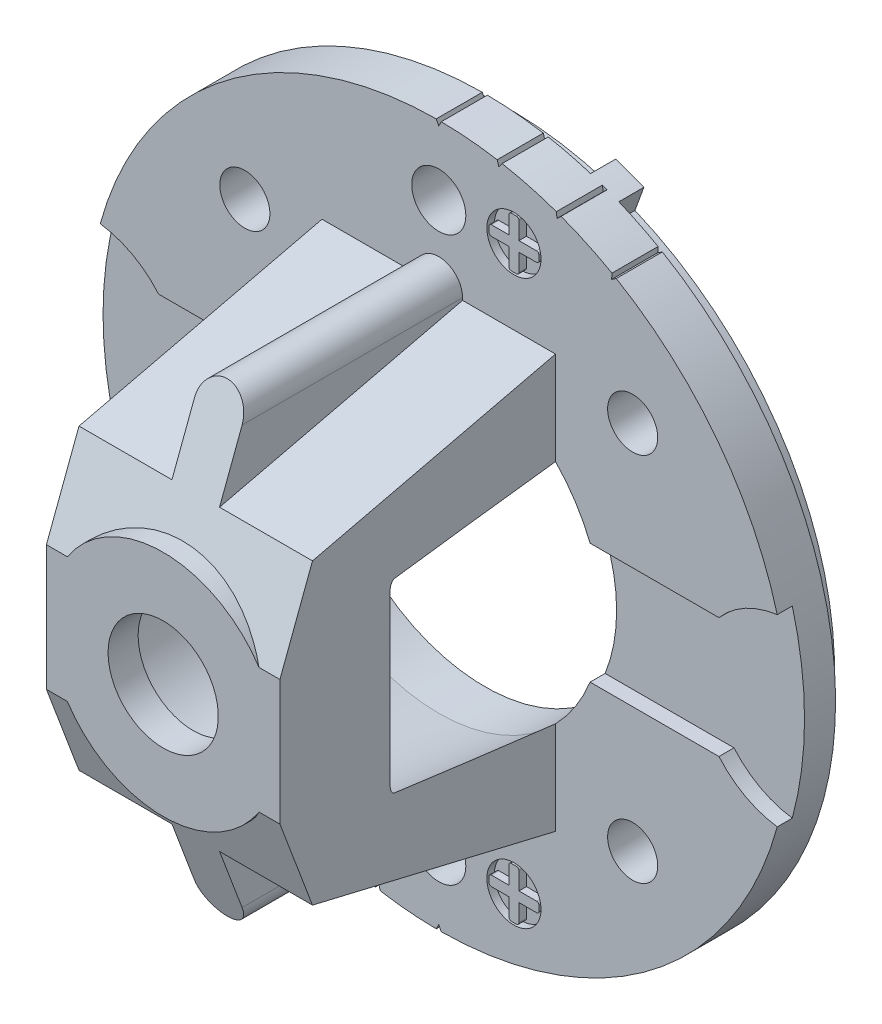
from build123d import *

# Parameters (mm, degrees)
SKETCH1_R           = 17.78
SKETCH1_R_2         = 2.794
BOSS_EXTRUDE1_DEPTH = 2.3368
SKETCH2_W           = 11.8364
SKETCH2_H           = 20.955
BOSS_EXTRUDE2_DEPTH = 13.97
CUT_EXTRUDE1_DEPTH  = 13.97
SKETCH4_R           = 5.8039
BOSS_EXTRUDE3_DEPTH = 2.54
BOSS_EXTRUDE4_DEPTH = 12.7
CUT_EXTRUDE2_DEPTH  = 34.817817929
SKETCH7_R           = 2.794
CUT_EXTRUDE3_DEPTH  = 30.969459892
SKETCH8_R           = 8.255
CUT_EXTRUDE4_DEPTH  = 2.3368
SKETCH10_R          = 16.4592
SKETCH10_R_2        = 15.4432
BOSS_EXTRUDE5_DEPTH = 1.27
CUT_EXTRUDE5_START  = -0.762
CUT_EXTRUDE5_DEPTH  = 0.762
BOSS_EXTRUDE6_DEPTH = 1.27
SKETCH13_R          = 1.3716
CUT_EXTRUDE6_DEPTH  = 29.764869247
SKETCH14_R          = 1.3716
CUT_EXTRUDE7_DEPTH  = 0.381
CUT_EXTRUDE8_START  = -2.3368
CUT_EXTRUDE8_DEPTH  = 2.3368
SKETCH19_R          = 1.27
CUT_EXTRUDE9_DEPTH  = 30.969190855


# Read off the part's stored shape, not the designer's step: Cut-Extrude8
with BuildPart() as part:
    # Sketch1 → Boss-Extrude1 (new body)
    with BuildSketch(Plane.XY):
        Circle(SKETCH1_R)
        Circle(SKETCH1_R_2, mode=Mode.SUBTRACT)
    extrude(amount=BOSS_EXTRUDE1_DEPTH)

    # Sketch2 → Boss-Extrude2 (add)
    with BuildSketch(Plane.XY.offset(2.3368)):
        Rectangle(SKETCH2_W, SKETCH2_H)
    extrude(amount=BOSS_EXTRUDE2_DEPTH)

    # Sketch3 → Cut-Extrude1 (cut)
    with BuildSketch(Plane(origin=(5.9182, 0, 0), x_dir=(0, 0, -1), z_dir=(1, 0, 0))):
        Polygon((-16.3068, 10.4775), (-2.3368, 10.4775), (-14.6558, 7.5565), (-16.3068, 3.175), align=None)
        Polygon((-2.3368, -10.4775), (-14.6558, -7.5565), (-16.3068, -3.175), (-16.3068, -10.4775), align=None)
    extrude(amount=-CUT_EXTRUDE1_DEPTH, mode=Mode.SUBTRACT)

    # Sketch4 → Boss-Extrude3 (add)
    with BuildSketch(Plane.XY.offset(16.3068)):
        Circle(SKETCH4_R)
    extrude(amount=-BOSS_EXTRUDE3_DEPTH)

    # Sketch5 → Boss-Extrude4 (add)
    with BuildSketch(Plane.XY.offset(2.3368)):
        with BuildLine():
            Line((1.2065, 10.5918), (1.2065, 3.922286562))
            ThreePointArc((1.2065, 3.922286562), (0, 2.715786562), (-1.2065, 3.922286562))
            Line((-1.2065, 3.922286562), (-1.2065, 10.5918))
            ThreePointArc((-1.2065, 10.5918), (0, 11.7983), (1.2065, 10.5918))
        make_face()
        with BuildLine():
            Line((1.2065, -10.5918), (1.2065, -3.922286562))
            ThreePointArc((1.2065, -3.922286562), (0, -2.715786562), (-1.2065, -3.922286562))
            Line((-1.2065, -3.922286562), (-1.2065, -10.5918))
            ThreePointArc((-1.2065, -10.5918), (0, -11.7983), (1.2065, -10.5918))
        make_face()
    extrude(amount=BOSS_EXTRUDE4_DEPTH)

    # Sketch6 → Cut-Extrude2 (cut, through all)
    with BuildSketch(Plane(origin=(5.9182, 0, 0), x_dir=(0, 0, -1), z_dir=(1, 0, 0))):
        Polygon((-13.05744058, -11.7983), (-14.6558, -7.5565), (-15.3162, -5.8039), (-16.3068, -5.8039), (-16.3068, -11.7983), align=None)
        Polygon((-16.3068, 5.8039), (-16.3068, 11.7983), (-13.05744058, 11.7983), (-15.3162, 5.8039), align=None)
    extrude(amount=-CUT_EXTRUDE2_DEPTH, mode=Mode.SUBTRACT)

    # Sketch7 → Cut-Extrude3 (cut, through all)
    with BuildSketch(Plane(origin=(0, 0, 0), x_dir=(-1, 0, 0), z_dir=(0, 0, -1))):
        Circle(SKETCH7_R)
    extrude(amount=-CUT_EXTRUDE3_DEPTH, mode=Mode.SUBTRACT)

    # Sketch8 → Cut-Extrude4 (cut)
    with BuildSketch(Plane(origin=(0, 0, 0), x_dir=(-1, 0, 0), z_dir=(0, 0, -1))):
        Circle(SKETCH8_R)
    extrude(amount=-CUT_EXTRUDE4_DEPTH, mode=Mode.SUBTRACT)

    # Sketch9 → Cut-Revolve1 (revolve, cut)
    with BuildSketch(Plane(origin=(0, 0, 0), x_dir=(0, 0, -1), z_dir=(1, 0, 0)), mode=Mode.PRIVATE) as cut_revolve1_sk:
        with BuildLine():
            Line((-10.486274354, 7.563529449), (-2.3368, 8.255))
            Line((-2.3368, 8.255), (0, 8.255))
            Line((0, 8.255), (0, 0))
            Line((0, 0), (-14.7828, 0))
            Line((-14.7828, 0), (-14.7828, 4.4958))
            ThreePointArc((-14.7828, 4.4958), (-14.708405122, 4.675405122), (-14.5288, 4.7498))
            Line((-14.5288, 4.7498), (-10.9728, 4.7498))
            ThreePointArc((-10.9728, 4.7498), (-10.793194878, 4.824194878), (-10.7188, 5.0038))
            Line((-10.7188, 5.0038), (-10.7188, 7.310438848))
            ThreePointArc((-10.7188, 7.310438848), (-10.651843425, 7.482284002), (-10.486274354, 7.563529449))
        make_face()
    revolve(cut_revolve1_sk.sketch.rotate(Axis((0, 0, -0.972451084), (0, 0, 1)), 90), axis=Axis((0, 0, -0.972451084), (0, 0, 1)), mode=Mode.SUBTRACT)

    # Sketch10 → Boss-Extrude5 (add)
    with BuildSketch(Plane(origin=(0, 0, 0), x_dir=(-1, 0, 0), z_dir=(0, 0, -1))):
        with Locations(Location((0, 0, 0), (0, 0, 180))):
            Circle(SKETCH10_R)
        Circle(SKETCH10_R_2, mode=Mode.SUBTRACT)
    extrude(amount=BOSS_EXTRUDE5_DEPTH)

    # Sketch11 → Cut-Extrude5 (cut)
    with BuildSketch(Plane.XY.offset(2.3368).offset(CUT_EXTRUDE5_START)):
        with BuildLine():
            Line((-14.203647529, 3.048), (-7.671683062, 3.048))
            ThreePointArc((-7.671683062, 3.048), (-8.255, 0), (-7.671683062, -3.048))
            Line((-7.671683062, -3.048), (-14.203647529, -3.048))
            ThreePointArc((-14.203647529, -3.048), (-15.532296087, -4.126551602), (-17.159060714, -4.657792976))
            ThreePointArc((-17.159060714, -4.657792976), (-17.78, 0), (-17.159060714, 4.657792976))
            ThreePointArc((-17.159060714, 4.657792976), (-15.532296087, 4.126551602), (-14.203647529, 3.048))
        make_face()
        with BuildLine():
            Line((14.203647529, 3.048), (7.671683062, 3.048))
            ThreePointArc((7.671683062, 3.048), (8.255, 0), (7.671683062, -3.048))
            Line((7.671683062, -3.048), (14.203647529, -3.048))
            ThreePointArc((14.203647529, -3.048), (15.532296087, -4.126551602), (17.159060714, -4.657792976))
            ThreePointArc((17.159060714, -4.657792976), (17.78, 0), (17.159060714, 4.657792976))
            ThreePointArc((17.159060714, 4.657792976), (15.532296087, 4.126551602), (14.203647529, 3.048))
        make_face()
    extrude(amount=CUT_EXTRUDE5_DEPTH, mode=Mode.SUBTRACT)

    # Sketch12 → Boss-Extrude6 (add)
    with BuildSketch(Plane(origin=(0, 0, -1.27), x_dir=(-1, 0, 0), z_dir=(0, 0, -1))):
        with BuildLine():
            Line((-6.791576658, 16.431764558), (-6.339387629, 15.18938541))
            ThreePointArc((-6.339387629, 15.18938541), (-5.629377943, 15.466588784), (-4.907296075, 15.710624108))
            Line((-4.907296075, 15.710624108), (-5.359485104, 16.953003257))
            ThreePointArc((-5.359485104, 16.953003257), (-6.081118148, 16.707734798), (-6.791576658, 16.431764558))
        make_face()
    extrude(amount=-BOSS_EXTRUDE6_DEPTH)

    # Sketch13 → Cut-Extrude6 (cut, through all)
    with BuildSketch(Plane.XY.offset(2.3368)):
        with Locations((0, 14.2748)):
            Circle(SKETCH13_R)
        with Locations(Location((0, -14.2748, 0), (0, 0, 302.999911245))):
            Circle(SKETCH13_R)
    extrude(amount=-CUT_EXTRUDE6_DEPTH, mode=Mode.SUBTRACT)

    # Sketch14 → Cut-Extrude7 (cut)
    # profile 1 of 2: a face of its own
    with BuildSketch(Plane.XY.offset(2.3368)):
        with Locations((3.81, 14.2748)):
            Circle(SKETCH14_R)
        with BuildLine():
            Line((5.08, 14.1478), (5.08, 14.4018))
            ThreePointArc((5.08, 14.4018), (5.042802561, 14.491602561), (4.953, 14.5288))
            Line((4.953, 14.5288), (4.064, 14.5288))
            Line((4.064, 14.5288), (4.064, 15.4178))
            ThreePointArc((4.064, 15.4178), (4.026802561, 15.507602561), (3.937, 15.5448))
            Line((3.937, 15.5448), (3.683, 15.5448))
            ThreePointArc((3.683, 15.5448), (3.593197439, 15.507602561), (3.556, 15.4178))
            Line((3.556, 15.4178), (3.556, 14.5288))
            Line((3.556, 14.5288), (2.667, 14.5288))
            ThreePointArc((2.667, 14.5288), (2.577197439, 14.491602561), (2.54, 14.4018))
            Line((2.54, 14.4018), (2.54, 14.1478))
            ThreePointArc((2.54, 14.1478), (2.577197439, 14.057997439), (2.667, 14.0208))
            Line((2.667, 14.0208), (3.556, 14.0208))
            Line((3.556, 14.0208), (3.556, 13.1318))
            ThreePointArc((3.556, 13.1318), (3.593197439, 13.041997439), (3.683, 13.0048))
            Line((3.683, 13.0048), (3.937, 13.0048))
            ThreePointArc((3.937, 13.0048), (4.026802561, 13.041997439), (4.064, 13.1318))
            Line((4.064, 13.1318), (4.064, 14.0208))
            Line((4.064, 14.0208), (4.953, 14.0208))
            ThreePointArc((4.953, 14.0208), (5.042802561, 14.057997439), (5.08, 14.1478))
        make_face(mode=Mode.SUBTRACT)
    # profile 2 of 2: a face of its own
    with BuildSketch(Plane.XY.offset(2.3368)):
        with Locations((3.81, -14.2748)):
            Circle(SKETCH14_R)
        with BuildLine():
            Line((3.556, -14.5288), (3.556, -15.4178))
            ThreePointArc((3.556, -15.4178), (3.593197439, -15.507602561), (3.683, -15.5448))
            Line((3.683, -15.5448), (3.937, -15.5448))
            ThreePointArc((3.937, -15.5448), (4.026802561, -15.507602561), (4.064, -15.4178))
            Line((4.064, -15.4178), (4.064, -14.5288))
            Line((4.064, -14.5288), (4.953, -14.5288))
            ThreePointArc((4.953, -14.5288), (5.042802561, -14.491602561), (5.08, -14.4018))
            Line((5.08, -14.4018), (5.08, -14.1478))
            ThreePointArc((5.08, -14.1478), (5.042802561, -14.057997439), (4.953, -14.0208))
            Line((4.953, -14.0208), (4.064, -14.0208))
            Line((4.064, -14.0208), (4.064, -13.1318))
            ThreePointArc((4.064, -13.1318), (4.026802561, -13.041997439), (3.937, -13.0048))
            Line((3.937, -13.0048), (3.683, -13.0048))
            ThreePointArc((3.683, -13.0048), (3.593197439, -13.041997439), (3.556, -13.1318))
            Line((3.556, -13.1318), (3.556, -14.0208))
            Line((3.556, -14.0208), (2.667, -14.0208))
            ThreePointArc((2.667, -14.0208), (2.577197439, -14.057997439), (2.54, -14.1478))
            Line((2.54, -14.1478), (2.54, -14.4018))
            ThreePointArc((2.54, -14.4018), (2.577197439, -14.491602561), (2.667, -14.5288))
            Line((2.667, -14.5288), (3.556, -14.5288))
        make_face(mode=Mode.SUBTRACT)
    extrude(amount=-CUT_EXTRUDE7_DEPTH, mode=Mode.SUBTRACT)

    # Cut-Extrude8 outline → Cut-Extrude8 (cut)
    with BuildSketch(Plane.XY.offset(2.3368).offset(CUT_EXTRUDE8_START)):
        Polygon((-0.127, 17.779546423), (0, 17.525546423), (0.127, 17.779546423), (0.237226789, 18), (-0.237226789, 18), align=None)
        Polygon((3.592675338, 18), (2.82295702, 18), (2.962315251, 17.531488481), (3.043279199, 17.259293993), (3.212456421, 17.487381844), align=None)
        Polygon((-8.999758438, -15.33403887), (-9, -15.334198362), (-9, -18), (-8.932184291, -18), (-8.779787985, -15.46103887), (-8.762773211, -15.177568417), align=None)
        Polygon((7.611494458, 18), (5.817850493, 18), (5.961622053, 16.750745133), (5.994089899, 16.468626649), (6.200303979, 16.663872016), align=None)
        Polygon((9, 18), (8.932184291, 18), (8.779787985, 15.46103887), (8.762773211, 15.177568417), (8.999758438, 15.33403887), (9, 15.334198362), align=None)
        Polygon((-6.200303979, -16.663872016), (-7.611494458, -18), (-5.817850493, -18), (-5.961622053, -16.750745133), (-5.994089899, -16.468626649), align=None)
        Polygon((-3.212456421, -17.487381844), (-3.592675338, -18), (-2.82295702, -18), (-2.962315251, -17.531488481), (-3.043279199, -17.259293993), align=None)
        Polygon((-0.237226789, -18), (0.237226789, -18), (0.127, -17.779546423), (0, -17.525546423), (-0.127, -17.779546423), align=None)
    extrude(amount=CUT_EXTRUDE8_DEPTH, mode=Mode.SUBTRACT)

    # Sketch19 → Cut-Extrude9 (cut, through all)
    with BuildSketch(Plane(origin=(0, 0, 0), x_dir=(-1, 0, 0), z_dir=(0, 0, -1))):
        with Locations((9.8298, 9.398)):
            Circle(SKETCH19_R)
        with Locations(Location((-9.8298, 9.398, 0), (0, 0, 180))):
            Circle(SKETCH19_R)
        with Locations((-9.8298, -9.398)):
            Circle(SKETCH19_R)
        with Locations(Location((9.8298, -9.398, 0), (0, 0, 180))):
            Circle(SKETCH19_R)
    extrude(amount=-CUT_EXTRUDE9_DEPTH, mode=Mode.SUBTRACT)


solid = part.part
